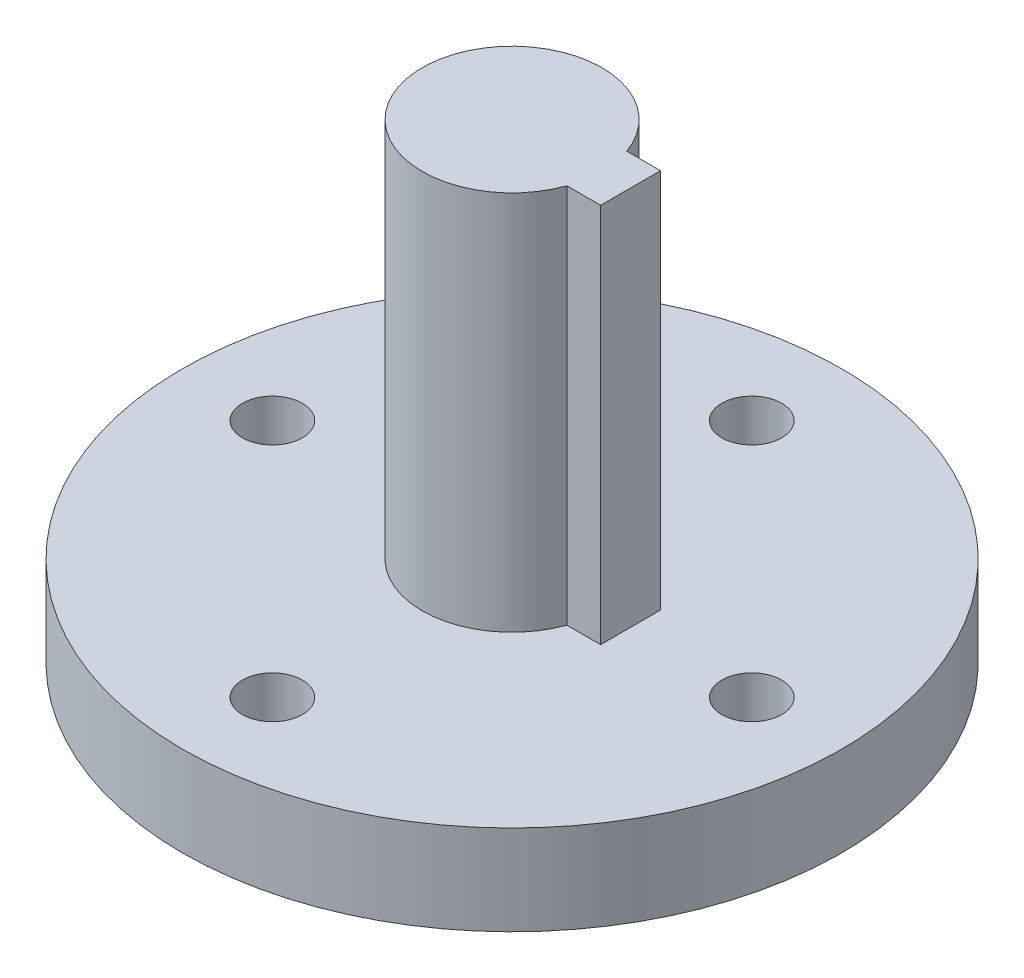
from build123d import *

# Parameters (mm, degrees)
SKETCH1_R           = 11
SKETCH1_R_2         = 1
BOSS_EXTRUDE1_DEPTH = 3
BOSS_EXTRUDE2_DEPTH = 12.7


with BuildPart() as part:
    # Sketch1 → Boss-Extrude1 (new body)
    with BuildSketch(Plane(origin=(0, 0, 0), x_dir=(1, 0, 0), z_dir=(0, 1, 0))):
        Circle(SKETCH1_R)
        with Locations((0, 8)):
            Circle(SKETCH1_R_2, mode=Mode.SUBTRACT)
        with Locations((8, 0)):
            Circle(SKETCH1_R_2, mode=Mode.SUBTRACT)
        with Locations((0, -8)):
            Circle(SKETCH1_R_2, mode=Mode.SUBTRACT)
        with Locations((-8, 0)):
            Circle(SKETCH1_R_2, mode=Mode.SUBTRACT)
    extrude(amount=BOSS_EXTRUDE1_DEPTH)

    # Sketch2 → Boss-Extrude2 (add)
    with BuildSketch(Plane(origin=(0, 3, 0), x_dir=(1, 0, 0), z_dir=(0, 1, 0))):
        with BuildLine():
            Line((2.828427125, 1), (3.955427125, 1))
            Line((3.955427125, 1), (3.955427125, -1))
            Line((3.955427125, -1), (2.828427125, -1))
            ThreePointArc((2.828427125, -1), (-3, 0), (2.828427125, 1))
        make_face()
    extrude(amount=BOSS_EXTRUDE2_DEPTH)


solid = part.part
